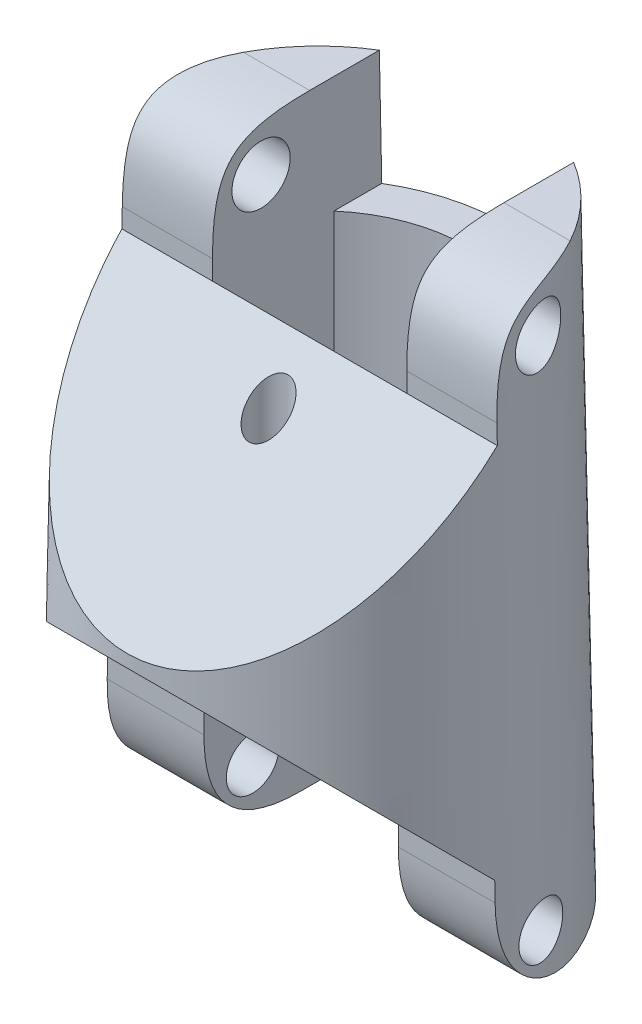
from build123d import *

# Parameters (mm, degrees)
SKETCH1_R                     = 10
BOSS_EXTRUDE1_DEPTH           = 25
BOSS_EXTRUDE1_TAPER           = 1
BOSS_EXTRUDE1_OTHER_WAY_DEPTH = 6
BOSS_EXTRUDE1_OTHER_WAY_TAPER = -1
CUT_EXTRUDE1_DEPTH            = 29.796026679
CUT_EXTRUDE1_DEPTH_BACK       = 29.796026679
SKETCH3_W                     = 10
SKETCH3_H                     = 6
CUT_EXTRUDE2_DEPTH            = 25
CUT_EXTRUDE3_DEPTH            = 31.907255886
CUT_EXTRUDE3_DEPTH_BACK       = 31.907255886
SKETCH4_R                     = 1.5
FILLET2_SIZE                  = 5
CUT_EXTRUDE5_DEPTH            = 29.796026836
CUT_EXTRUDE5_DEPTH_BACK       = 29.796026836
SKETCH8_W                     = 10
SKETCH8_H                     = 6
CUT_EXTRUDE6_DEPTH            = 30.113855333
CUT_EXTRUDE7_DEPTH            = 29.75944341
CUT_EXTRUDE8_DEPTH            = 31.873174281
CUT_EXTRUDE8_DEPTH_BACK       = 31.873174281
SKETCH9_R                     = 1.351518808
FILLET3_SIZE                  = 5
SKETCH10_R                    = 1
CUT_EXTRUDE9_DEPTH            = 29.749923286


with BuildPart() as part:
    # Sketch1 → Boss-Extrude1 (new body)
    with BuildSketch(Plane(origin=(0, 0, 0), x_dir=(1, 0, 0), z_dir=(0, 1, 0))):
        Circle(SKETCH1_R)
    extrude(amount=BOSS_EXTRUDE1_DEPTH, taper=BOSS_EXTRUDE1_TAPER)

    # Sketch1 → Boss-Extrude1 other way (add)
    with BuildSketch(Plane(origin=(0, 0, 0), x_dir=(1, 0, 0), z_dir=(0, 1, 0))):
        Circle(SKETCH1_R)
    extrude(amount=-BOSS_EXTRUDE1_OTHER_WAY_DEPTH, taper=BOSS_EXTRUDE1_OTHER_WAY_TAPER)

    # Sketch2 → Cut-Extrude1 (cut, two sides: drawn at the far end of the back side and taken through both)
    with BuildSketch(Plane(origin=(0, 0, 0), x_dir=(0, 0, -1), z_dir=(1, 0, 0)).offset(-CUT_EXTRUDE1_DEPTH_BACK)):
        Polygon((-0.436376623, 25), (-0.436376623, 19), (-12.679815256, 6.756561367), (-12.679815256, 25), align=None)
    extrude(amount=CUT_EXTRUDE1_DEPTH + CUT_EXTRUDE1_DEPTH_BACK, mode=Mode.SUBTRACT)

    # Sketch3 → Cut-Extrude2 (cut)
    with BuildSketch(Plane.XY.offset(0.436376623)):
        with Locations((0, 22)):
            Rectangle(SKETCH3_W, SKETCH3_H)
    extrude(amount=-CUT_EXTRUDE2_DEPTH, mode=Mode.SUBTRACT)

    # Sketch4 → Cut-Extrude3 (cut, two sides: drawn at the far end of the back side and taken through both)
    with BuildSketch(Plane(origin=(-5, 0, 0), x_dir=(0, 0, -1), z_dir=(1, 0, 0)).offset(-CUT_EXTRUDE3_DEPTH_BACK)):
        with Locations(Location((2.063623377, 22.5, 0), (0, 0, 90))):
            Circle(SKETCH4_R)
    extrude(amount=CUT_EXTRUDE3_DEPTH + CUT_EXTRUDE3_DEPTH_BACK, mode=Mode.SUBTRACT)

    # Fillet2
    # a fillet whose section is not a circle: 5 mm, written as the material it takes off along each edge
    with BuildSketch(Plane(origin=(-7.5, 25, 0.436376623), x_dir=(0, -1, 0), z_dir=(1, 0, 0))) as fillet2_piece_1:
        with BuildLine():
            Bezier((FILLET2_SIZE, 0), (0, 0), (0, FILLET2_SIZE), weights=[1, 1.5, 1])
            Line((0, FILLET2_SIZE), (0, 0))
            Line((0, 0), (FILLET2_SIZE, 0))
        make_face()
    extrude(amount=29.553662519, mode=Mode.SUBTRACT)
    with BuildSketch(Plane(origin=(-22.053662519, 25, 0.436376623), x_dir=(0, 0, -1), z_dir=(1, 0, 0))) as fillet2_piece_2:
        with BuildLine():
            Bezier((FILLET2_SIZE, 0), (0, 0), (0, -FILLET2_SIZE), weights=[1, 1.5, 1])
            Line((0, -FILLET2_SIZE), (0, 0))
            Line((0, 0), (FILLET2_SIZE, 0))
        make_face()
    extrude(amount=29.553662519, mode=Mode.SUBTRACT)

    # Sketch7 → Cut-Extrude5 (cut, two sides: drawn at the far end of the back side and taken through both)
    with BuildSketch(Plane(origin=(0, 0, 0), x_dir=(0, 0, -1), z_dir=(1, 0, 0)).offset(-CUT_EXTRUDE5_DEPTH_BACK)):
        Polygon((-0.873019237, -6), (-0.873019237, 0), (-11.31781305, 10.444793812), (-11.31781305, -6), align=None)
    extrude(amount=CUT_EXTRUDE5_DEPTH + CUT_EXTRUDE5_DEPTH_BACK, mode=Mode.SUBTRACT)

    # Sketch8 → Cut-Extrude6 (cut, through all)
    with BuildSketch(Plane.XY.offset(0.873019237)):
        with Locations((0, -3)):
            Rectangle(SKETCH8_W, SKETCH8_H)
    extrude(amount=-CUT_EXTRUDE6_DEPTH, mode=Mode.SUBTRACT)

    # Sketch6 → Cut-Extrude7 (cut, through all)
    with BuildSketch(Plane(origin=(0, 19, 0), x_dir=(1, 0, 0), z_dir=(0, 1, 0))):
        with BuildLine():
            Line((5, 5.814090598), (5, -0.436376623))
            Line((5, -0.436376623), (-5, -0.436376623))
            Line((-5, -0.436376623), (-5, 5.814090598))
            ThreePointArc((-5, 5.814090598), (0, 7.668353766), (5, 5.814090598))
        make_face()
    extrude(amount=-CUT_EXTRUDE7_DEPTH, mode=Mode.SUBTRACT)

    # Sketch9 → Cut-Extrude8 (cut, two sides: drawn at the far end of the back side and taken through both)
    with BuildSketch(Plane(origin=(-5, 0, 0), x_dir=(0, 0, -1), z_dir=(1, 0, 0)).offset(-CUT_EXTRUDE8_DEPTH_BACK)):
        with Locations(Location((1.626980763, -3.5, 0), (0, 0, 90))):
            Circle(SKETCH9_R)
    extrude(amount=CUT_EXTRUDE8_DEPTH + CUT_EXTRUDE8_DEPTH_BACK, mode=Mode.SUBTRACT)

    # Fillet3
    # a fillet whose section is not a circle: 5 mm, written as the material it takes off along each edge
    with BuildSketch(Plane(origin=(22.566946591, -6, 0.873019237), x_dir=(0, 0, -1), z_dir=(-1, 0, 0))) as fillet3_piece_1:
        with BuildLine():
            Bezier((FILLET3_SIZE, 0), (0, 0), (0, -FILLET3_SIZE), weights=[1, 1, 1])
            Line((0, -FILLET3_SIZE), (0, 0))
            Line((0, 0), (FILLET3_SIZE, 0))
        make_face()
    extrude(amount=30.066946591, mode=Mode.SUBTRACT)
    with BuildSketch(Plane(origin=(7.5, -6, 0.873019237), x_dir=(0, 1, 0), z_dir=(-1, 0, 0))) as fillet3_piece_2:
        with BuildLine():
            Bezier((FILLET3_SIZE, 0), (0, 0), (0, FILLET3_SIZE), weights=[1, 1, 1])
            Line((0, FILLET3_SIZE), (0, 0))
            Line((0, 0), (FILLET3_SIZE, 0))
        make_face()
    extrude(amount=30.066946591, mode=Mode.SUBTRACT)

    # Sketch10 → Cut-Extrude9 (cut, through all)
    with BuildSketch(Plane(origin=(0, 19, 0), x_dir=(1, 0, 0), z_dir=(0, 1, 0))):
        with Locations(Location((0, -2.550318856, 0), (0, 0, 270))):
            Circle(SKETCH10_R)
    extrude(amount=-CUT_EXTRUDE9_DEPTH, mode=Mode.SUBTRACT)


solid = part.part
